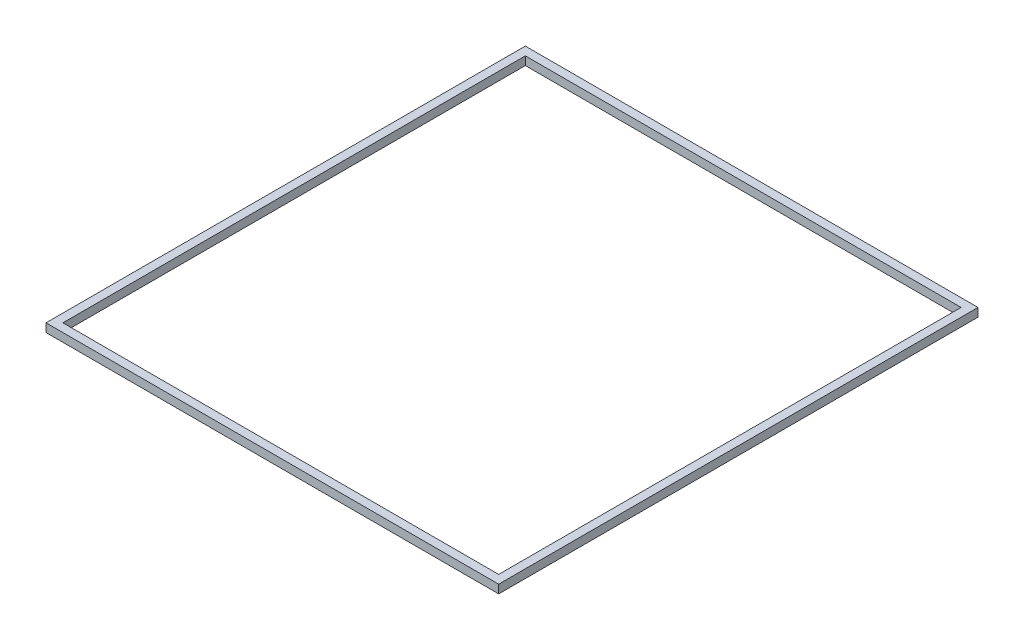
from build123d import *

# Parameters (mm, degrees)
SKETCH1_W           = 85
SKETCH1_H           = 90
SKETCH1_W_2         = 81.825
SKETCH1_H_2         = 86.825
BOSS_EXTRUDE1_DEPTH = 1.5875


with BuildPart() as part:
    # Sketch1 → Boss-Extrude1 (new body)
    with BuildSketch(Plane(origin=(0, 0, 0), x_dir=(1, 0, 0), z_dir=(0, 1, 0))):
        with Locations((42.5, 45)):
            Rectangle(SKETCH1_W, SKETCH1_H)
        with Locations((42.5, 45)):
            Rectangle(SKETCH1_W_2, SKETCH1_H_2, mode=Mode.SUBTRACT)
    extrude(amount=BOSS_EXTRUDE1_DEPTH)


solid = part.part
